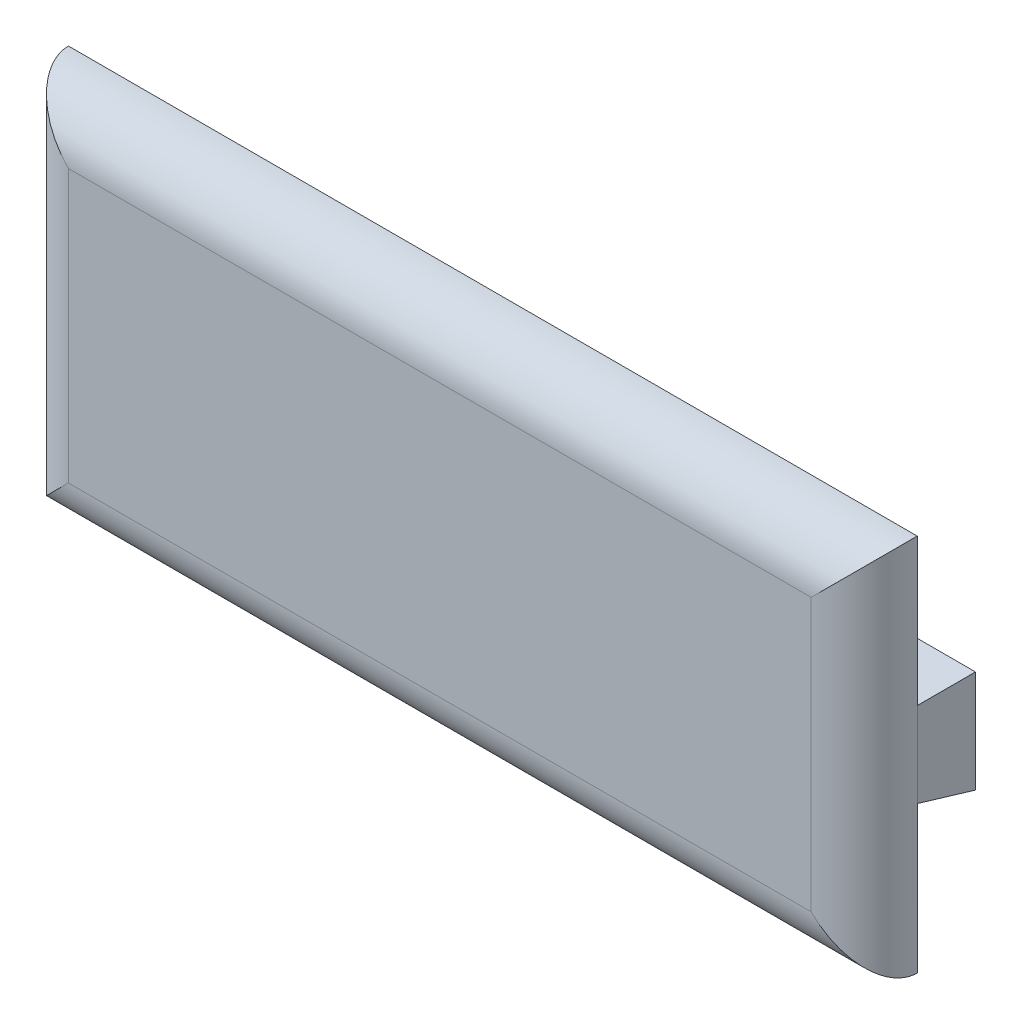
from build123d import *

# Parameters (mm, degrees)
SKETCH1_W           = 24
SKETCH1_H           = 10.7
BOSS_EXTRUDE1_DEPTH = 1.5
SKETCH2_W           = 24
SKETCH2_H           = 2.4
BOSS_EXTRUDE2_DEPTH = 1.4
BOSS_EXTRUDE2_DRAFT = -10
FILLET1_R           = 1.5


with BuildPart() as part:
    # Sketch1 → Boss-Extrude1 (new body)
    with BuildSketch(Plane.XY):
        Rectangle(SKETCH1_W, SKETCH1_H)
    extrude(amount=BOSS_EXTRUDE1_DEPTH)


with BuildPart() as boss_extrude2_tool:
    # Sketch2 → Boss-Extrude2 (with draft: the straight prism first)
    with BuildSketch(Plane(origin=(0, 0, 0), x_dir=(-1, 0, 0), z_dir=(0, 0, -1))):
        Rectangle(SKETCH2_W, SKETCH2_H)
    extrude(amount=BOSS_EXTRUDE2_DEPTH)
    # Boss-Extrude2: the draft: its side faces are tilted about the plane it starts from
    boss_extrude2_sides = [boss_extrude2_tool.faces().sort_by_distance(p)[0] for p in [
        (12, 0, -0.7),
        (0, -1.2, -0.7),
        (-12, 0, -0.7),
        (0, 1.2, -0.7),
    ]]
    draft(boss_extrude2_sides, Plane(origin=(0, 0, 0), x_dir=(-1, 0, 0), z_dir=(0, 0, -1)), BOSS_EXTRUDE2_DRAFT)


with BuildPart() as part_1:
    add(part.part)

    # Boss-Extrude2: add boss_extrude2_tool
    add(boss_extrude2_tool.part)

    # Fillet1
    fillet1_edges = [part_1.edges().sort_by_distance(p)[0] for p in [
        (0, -5.35, 1.5),
        (-12, 0, 1.5),
        (0, 5.35, 1.5),
        (12, 0, 1.5),
    ]]
    fillet(fillet1_edges, radius=FILLET1_R - 0.0001)  # a hair under: the kernel refuses the full size


solid = part_1.part
